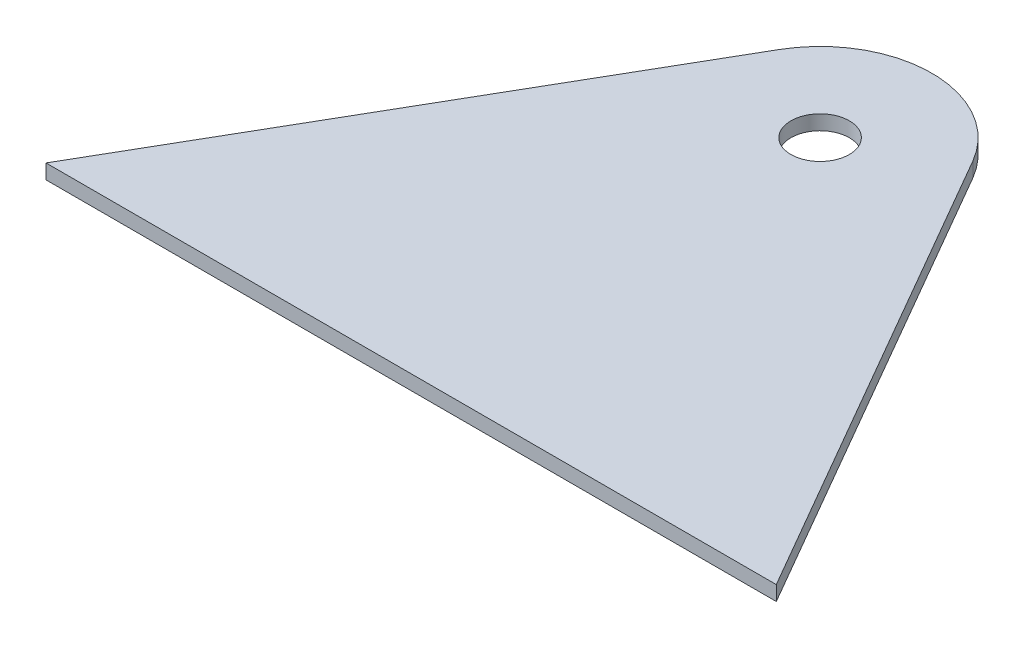
from build123d import *

# Parameters (mm, degrees)
SKETCH1_R           = 6.35
BOSS_EXTRUDE1_DEPTH = 3.19024


with BuildPart() as part:
    # Sketch1 → Boss-Extrude1 (new body)
    with BuildSketch(Plane(origin=(0, 0, 0), x_dir=(1, 0, 0), z_dir=(0, 1, 0))):
        with BuildLine():
            Line((-79.375, 0), (79.375, 0))
            Line((79.375, 0), (21.036420802, 101.045383213))
            ThreePointArc((21.036420802, 101.045383213), (0, 113.190766425), (-21.036420802, 101.045383213))
            Line((-21.036420802, 101.045383213), (-79.375, 0))
        make_face()
        with Locations((0, 88.9)):
            Circle(SKETCH1_R, mode=Mode.SUBTRACT)
    extrude(amount=BOSS_EXTRUDE1_DEPTH)


solid = part.part
